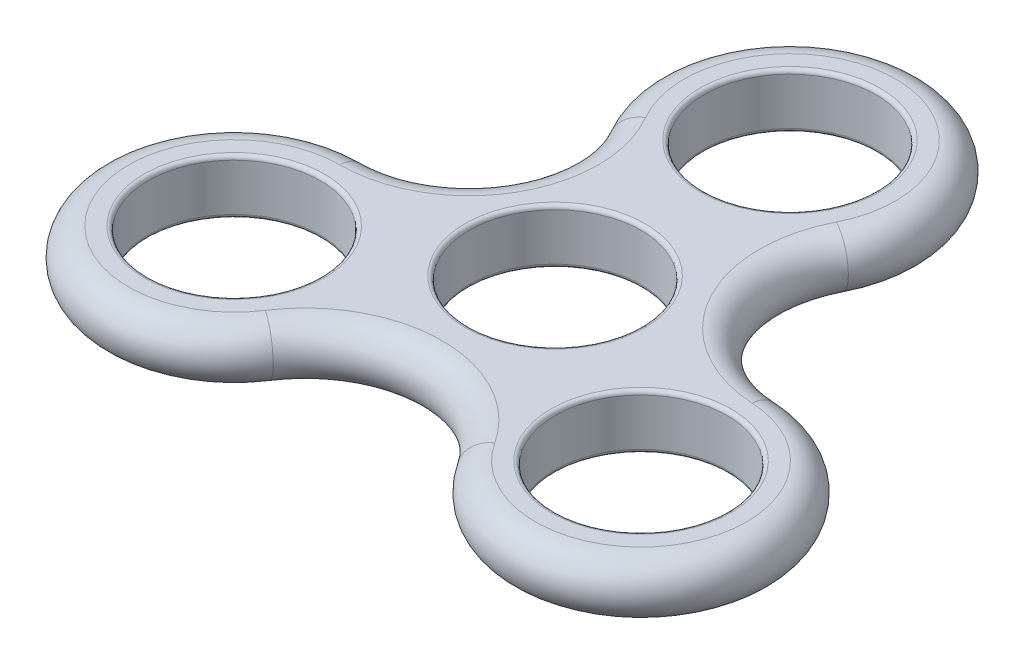
from build123d import *

# Parameters (mm, degrees)
SKETCH1_R           = 11
BOSS_EXTRUDE1_DEPTH = 3.5
FILLET1_R           = 3.5
FILLET2_R           = 0.5


with BuildPart() as part:
    # Sketch1 → Boss-Extrude1 (new, symmetric)
    with BuildSketch(Plane(origin=(0, 0, 0), x_dir=(1, 0, 0), z_dir=(0, 1, 0))):
        with BuildLine():
            ThreePointArc((15.15533525, 22.298323983), (-0.454072275, 46.993934752), (-14.722431864, 21.5))
            ThreePointArc((-14.722431864, 21.5), (-14.722431864, 8.5), (-25.980762114, 2))
            ThreePointArc((-25.980762114, 2), (-40.924977457, -23.103729251), (-11.733247406, -24.27406732))
            ThreePointArc((-11.733247406, -24.27406732), (0, -17.911534525), (11.733247406, -24.27406732))
            ThreePointArc((11.733247406, -24.27406732), (40.703193978, -23.5), (26.888582656, 1.975743338))
            ThreePointArc((26.888582656, 1.975743338), (15.51184392, 8.955767263), (15.15533525, 22.298323983))
        make_face()
        with Locations(Location((0, 30, 0), (0, 0, 270))):
            Circle(SKETCH1_R, mode=Mode.SUBTRACT)
        with Locations(Location((0, 0, 0), (0, 0, 270))):
            Circle(SKETCH1_R, mode=Mode.SUBTRACT)
        with Locations(Location((-25.980762114, -15, 0), (0, 0, 270))):
            Circle(SKETCH1_R, mode=Mode.SUBTRACT)
        with Locations(Location((25.980762114, -15, 0), (0, 0, 270))):
            Circle(SKETCH1_R, mode=Mode.SUBTRACT)
    extrude(amount=BOSS_EXTRUDE1_DEPTH, both=True)

    # Fillet1
    fillet1_edges = [part.edges().sort_by_distance(p)[0] for p in [
        (-14.722431864, 3.5, -8.5),
        (15.51184392, -3.5, -8.955767263),
        (40.703193978, -3.5, 23.5),
        (0, -3.5, 17.911534525),
        (-40.924977457, -3.5, 23.103729251),
        (-0.454072275, -3.5, -46.993934752),
    ]]
    fillet(fillet1_edges, radius=FILLET1_R - 0.0001)  # a hair under: the kernel refuses the full size

    # Fillet2
    fillet2_edges = [part.edges().sort_by_distance(p)[0] for p in [
        (-25.980762114, -3.5, 4),
        (25.980762114, -3.5, 4),
        (0, -3.5, -11),
        (0, -3.5, -41),
        (0, 3.5, -41),
        (0, 3.5, -11),
        (25.980762114, 3.5, 4),
        (-25.980762114, 3.5, 4),
    ]]
    fillet(fillet2_edges, radius=FILLET2_R)


solid = part.part
